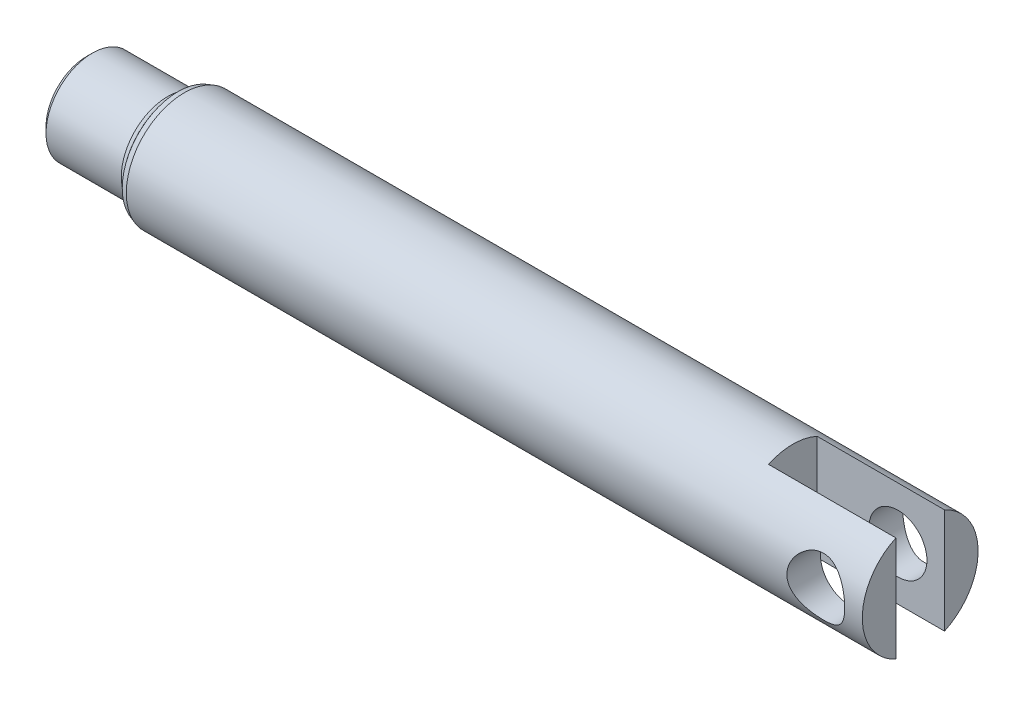
from build123d import *

# Parameters (mm, degrees)
SKETCH2_W               = 2.1
SKETCH2_H               = 5.824035358
CUT_EXTRUDE1_DEPTH      = 5.5
CUT_EXTRUDE2_DEPTH      = 19.516276624
CUT_EXTRUDE2_DEPTH_BACK = 19.516276624
SKETCH3_R               = 1.25
CHAMFER1_SIZE           = 0.25
CHAMFER2_SIZE           = 0.218100459


with BuildPart() as part:
    # Sketch1 → Revolve1 (revolve)
    with BuildSketch(Plane.XY, mode=Mode.PRIVATE) as revolve1_sk:
        with BuildLine():
            Line((-18, 2), (-14.5, 2))
            ThreePointArc((-14.5, 2), (-14.208348655, 2.208348655), (-14, 2.5))
            Line((-14, 2.5), (18, 2.5))
            Line((18, 2.5), (18, 0))
            Line((18, 0), (-18, 0))
            Line((-18, 0), (-18, 2))
        make_face()
    revolve(revolve1_sk.sketch.rotate(Axis((18, 0, 0), (-1, 0, 0)), 90), axis=Axis((18, 0, 0), (-1, 0, 0)))

    # Sketch2 → Cut-Extrude1 (cut)
    with BuildSketch(Plane(origin=(18, 0, 0), x_dir=(0, 0, -1), z_dir=(1, 0, 0))):
        Rectangle(SKETCH2_W, SKETCH2_H)
    extrude(amount=-CUT_EXTRUDE1_DEPTH, mode=Mode.SUBTRACT)

    # Sketch3 → Cut-Extrude2 (cut, two sides: drawn at the far end of the back side and taken through both)
    with BuildSketch(Plane.XY.offset(-1.05).offset(-CUT_EXTRUDE2_DEPTH_BACK)):
        with Locations((15.991222224, 0)):
            Circle(SKETCH3_R)
    extrude(amount=CUT_EXTRUDE2_DEPTH + CUT_EXTRUDE2_DEPTH_BACK, mode=Mode.SUBTRACT)

    # Chamfer1
    chamfer1_edges = [part.edges().sort_by_distance(p)[0] for p in [
        (-18, 0, 2),
    ]]
    chamfer(chamfer1_edges, length=CHAMFER1_SIZE)

    # Chamfer2
    # the kernel refuses this chamfer: 0.218100459, 0.1 mm, written as the material it takes off along each edge
    with BuildSketch(Plane(origin=(-14, 0, 0), x_dir=(0, 0, -1), z_dir=(0, 1, 0))) as chamfer2_piece_1:
        with BuildLine():
            Line((2.407857149, 0.050754033), (2.5, -CHAMFER2_SIZE * 0.99999999787))
            Line((2.5, -CHAMFER2_SIZE * 0.99999999787), (2.5, 0))
            ThreePointArc((2.5, 0), (2.450478775, 0.025833705), (2.407857149, 0.050754033))
        make_face()
    revolve(axis=Axis((-14, 0, 0), (-1, 0, 0)), mode=Mode.SUBTRACT)


solid = part.part
